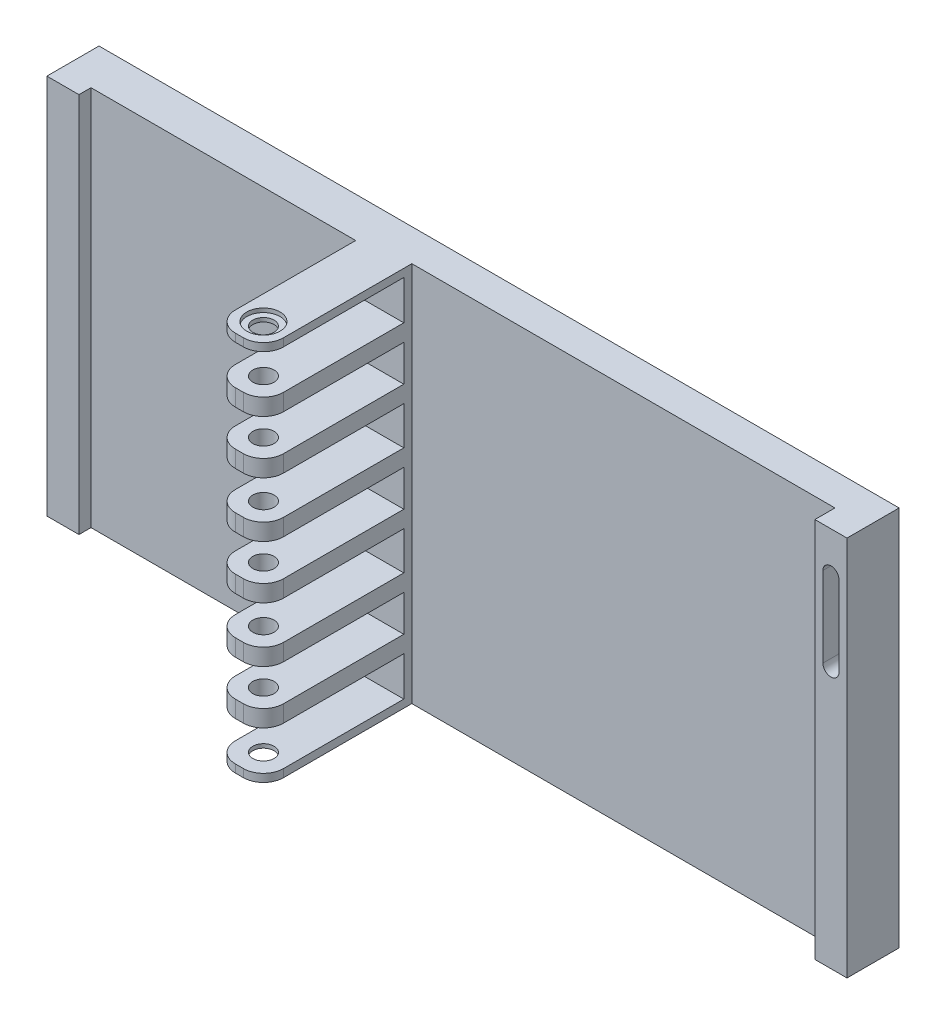
from build123d import *

# Parameters (mm, degrees)
SKETCH1_W            = 95
SKETCH1_H            = 12
BOSS_EXTRUDE1_DEPTH  = 10
SKETCH3_W            = 12
SKETCH3_H            = 1.975
SKETCH3_H_2          = 4.2
BOSS_EXTRUDE2_DEPTH  = 35
FILLET1_R            = 5
FILLET1_OF_MIRROR1_R = 5
SKETCH5_R            = 2.65
CUT_EXTRUDE1_DEPTH   = 106.80170131
SKETCH7_R            = 4.15
SKETCH7_R_2          = 2.65
CUT_EXTRUDE2_DEPTH   = 1
SKETCH8_W            = 74
SKETCH8_H            = 95
SKETCH8_W_2          = 113.5
BOSS_EXTRUDE3_DEPTH  = 8
SKETCH9_W            = 8
SKETCH9_H            = 95
BOSS_EXTRUDE4_DEPTH  = 5
CUT_EXTRUDE3_DEPTH   = 10
BOSS_EXTRUDE5_REACH  = 165.708
SKETCH12_W           = 95
SKETCH12_H           = 2


with BuildPart() as part:
    # Sketch1 → Boss-Extrude1 (new body)
    with BuildSketch(Plane(origin=(0, 0, 0), x_dir=(0, 1, 0), z_dir=(0, 0, 1))):
        with Locations((-47.5, 6)):
            Rectangle(SKETCH1_W, SKETCH1_H)
    extrude(amount=BOSS_EXTRUDE1_DEPTH)

    # Sketch3 → Boss-Extrude2 (add)
    with BuildSketch(Plane.XY.offset(10)):
        with Locations((-6, -0.9875)):
            Rectangle(SKETCH3_W, SKETCH3_H)
        with Locations((-6, -13.875)):
            Rectangle(SKETCH3_W, SKETCH3_H_2)
        with Locations((-6, -27.125)):
            Rectangle(SKETCH3_W, SKETCH3_H_2)
        with Locations((-6, -40.875)):
            Rectangle(SKETCH3_W, SKETCH3_H_2)
    boss_extrude2 = extrude(amount=BOSS_EXTRUDE2_DEPTH)

    # Fillet1
    fillet1_edges = [part.edges().sort_by_distance(p)[0] for p in [
        (-12, -0.9875, 45),
        (0, -0.9875, 45),
        (-12, -13.875, 45),
        (0, -13.875, 45),
        (-12, -40.875, 45),
        (-12, -27.125, 45),
        (0, -27.125, 45),
        (0, -40.875, 45),
    ]]
    fillet(fillet1_edges, radius=FILLET1_R)

    # Mirror1: Boss-Extrude2 across plane
    add(boss_extrude2.mirror(Plane.ZX.offset(-47.5)))

    # Fillet1 of Mirror1
    fillet1_of_mirror1_edges = [part.edges().sort_by_distance(p)[0] for p in [
        (-12, -94.0125, 45),
        (0, -94.0125, 45),
        (-12, -81.125, 45),
        (0, -81.125, 45),
        (-12, -54.125, 45),
        (-12, -67.875, 45),
        (0, -67.875, 45),
        (0, -54.125, 45),
    ]]
    fillet(fillet1_of_mirror1_edges, radius=FILLET1_OF_MIRROR1_R)

    # Sketch5 → Cut-Extrude1 (cut, through all)
    with BuildSketch(Plane(origin=(0, 0, 0), x_dir=(-1, 0, 0), z_dir=(0, 1, 0))):
        with Locations((6, 39)):
            Circle(SKETCH5_R)
    extrude(amount=-CUT_EXTRUDE1_DEPTH, mode=Mode.SUBTRACT)

    # Sketch7 → Cut-Extrude2 (cut)
    with BuildSketch(Plane(origin=(0, 0, 0), x_dir=(-1, 0, 0), z_dir=(0, 1, 0))):
        with Locations((6, 39)):
            Circle(SKETCH7_R)
        with Locations((6, 39)):
            Circle(SKETCH7_R_2, mode=Mode.SUBTRACT)
    cut_extrude2 = extrude(amount=-CUT_EXTRUDE2_DEPTH, mode=Mode.SUBTRACT)

    # Mirror2: Cut-Extrude2 across plane
    add(cut_extrude2.mirror(Plane.ZX.offset(-47.5)), mode=Mode.SUBTRACT)

    # Sketch8 → Boss-Extrude3 (add)
    with BuildSketch(Plane(origin=(0, 0, 0), x_dir=(1, 0, 0), z_dir=(0, 0, -1))):
        with Locations((-49, 47.5)):
            Rectangle(SKETCH8_W, SKETCH8_H)
        with Locations((56.75, 47.5)):
            Rectangle(SKETCH8_W_2, SKETCH8_H)
    extrude(amount=-BOSS_EXTRUDE3_DEPTH)

    # Sketch9 → Boss-Extrude4 (add)
    with BuildSketch(Plane.XY.offset(8)):
        with Locations((109.5, -47.5)):
            Rectangle(SKETCH9_W, SKETCH9_H)
        with Locations((-82, -47.5)):
            Rectangle(SKETCH9_W, SKETCH9_H)
    extrude(amount=BOSS_EXTRUDE4_DEPTH)

    # Sketch11 → Cut-Extrude3 (cut)
    with BuildSketch(Plane.XY.offset(13)):
        with BuildLine():
            Line((111.5, -10), (111.5, -30))
            ThreePointArc((111.5, -30), (109.5, -32), (107.5, -30))
            Line((107.5, -30), (107.5, -10))
            ThreePointArc((107.5, -10), (109.5, -8), (111.5, -10))
        make_face()
    extrude(amount=-CUT_EXTRUDE3_DEPTH, mode=Mode.SUBTRACT)

    # Sketch12 → Boss-Extrude5 (add, up to next)
    with BuildSketch(Plane(origin=(-12, 0, 0), x_dir=(0, -1, 0), z_dir=(-1, 0, 0)), mode=Mode.PRIVATE) as boss_extrude5_sk1:
        with Locations((47.5, 9)):
            Rectangle(SKETCH12_W, SKETCH12_H)
    boss_extrude5_tool1 = extrude(boss_extrude5_sk1.sketch, amount=BOSS_EXTRUDE5_REACH, mode=Mode.PRIVATE) - part.part
    add(boss_extrude5_tool1.solids().sort_by_distance((-12, -47.5, 9))[0])


solid = part.part
